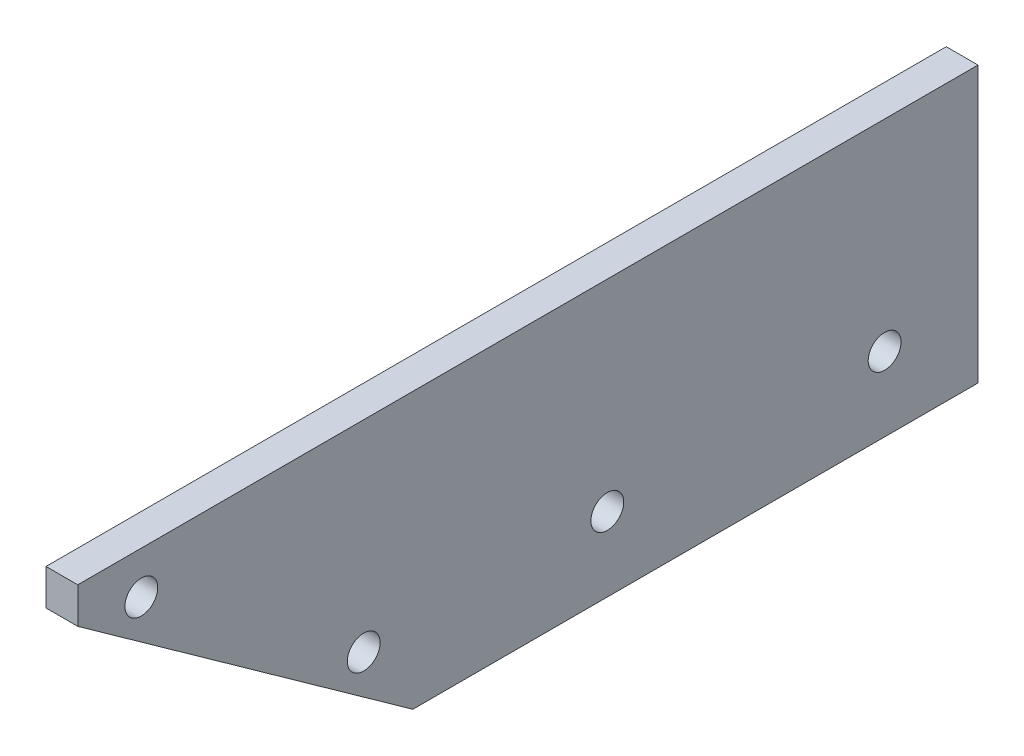
from build123d import *

# Parameters (mm, degrees)
SKIZZE1_W                       = 85
SKIZZE1_H                       = 26
AUFSATZ_LINEAR_AUSTRAGEN1_DEPTH = 3
SKIZZE2_R                       = 1.55
SCHNITT_LINEAR_AUSTRAGEN1_DEPTH = 89.938180777
SCHNITT_LINEAR_AUSTRAGEN2_DEPTH = 89.938180777


with BuildPart() as part:
    # Skizze1 → Aufsatz-Linear austragen1 (new body)
    with BuildSketch(Plane(origin=(0, 0, 0), x_dir=(0, 0, -1), z_dir=(1, 0, 0))):
        with Locations((42.5, 13)):
            Rectangle(SKIZZE1_W, SKIZZE1_H)
    extrude(amount=AUFSATZ_LINEAR_AUSTRAGEN1_DEPTH)

    # Skizze2 → Schnitt-Linear austragen1 (cut, through all)
    with BuildSketch(Plane(origin=(3, 0, 0), x_dir=(0, 0, -1), z_dir=(1, 0, 0))):
        with Locations((6, 22)):
            Circle(SKIZZE2_R)
        with Locations((27, 7)):
            Circle(SKIZZE2_R)
        with Locations((50, 7)):
            Circle(SKIZZE2_R)
        with Locations((76.183749339, 7)):
            Circle(SKIZZE2_R)
    extrude(amount=-SCHNITT_LINEAR_AUSTRAGEN1_DEPTH, mode=Mode.SUBTRACT)

    # Skizze3 → Schnitt-Linear austragen2 (cut, through all)
    with BuildSketch(Plane(origin=(3, 0, 0), x_dir=(0, 0, -1), z_dir=(1, 0, 0))):
        Polygon((0, 22.599003457), (31.63860484, 0), (0, 0), align=None)
    extrude(amount=-SCHNITT_LINEAR_AUSTRAGEN2_DEPTH, mode=Mode.SUBTRACT)


solid = part.part
